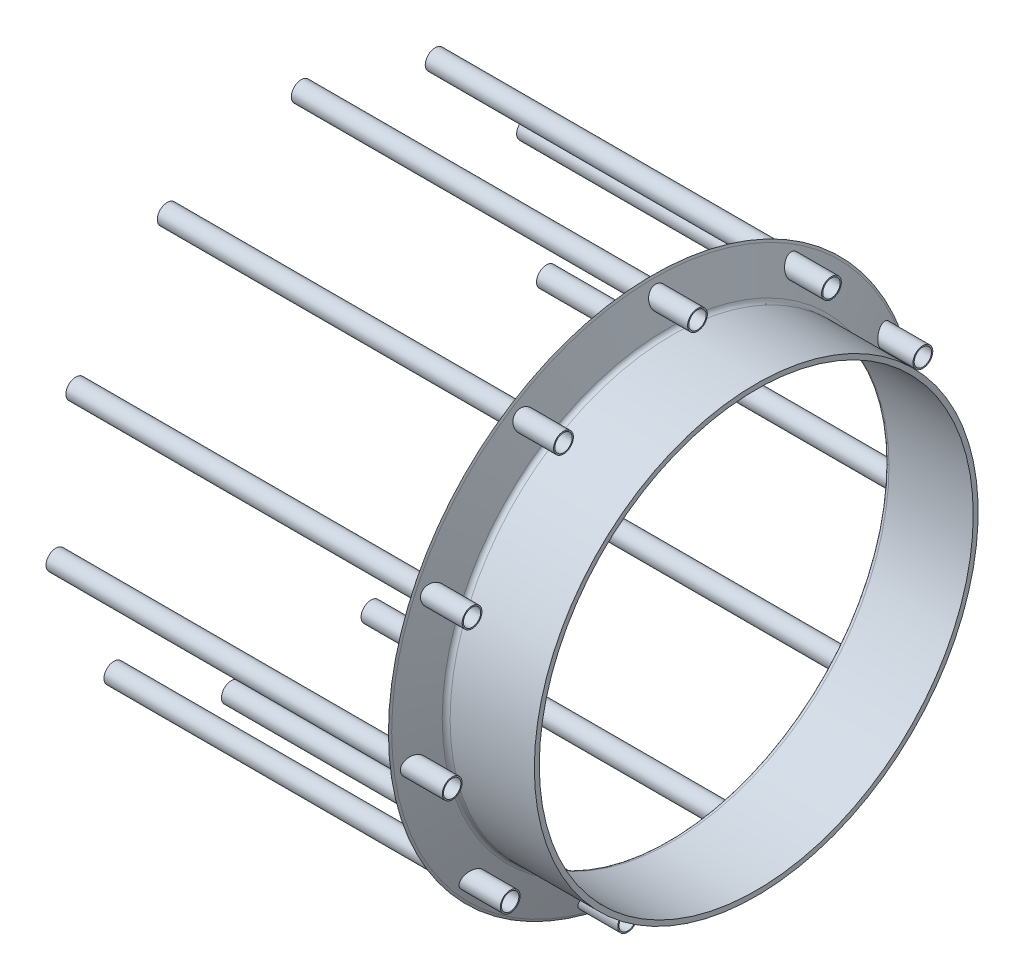
from build123d import *

# Parameters (mm, degrees)
FILLET1_R           = 5
SKETCH3_R           = 2
CUT_EXTRUDE1_DEPTH  = 10
CIRPATTERN1_COUNT   = 11
SKETCH3_2_R         = 2
BOSS_EXTRUDE1_DEPTH = 80
CIRPATTERN2_COUNT   = 11
SKETCH9_R           = 1.75
CUT_EXTRUDE2_DEPTH  = 90
CIRPATTERN3_COUNT   = 11


with BuildPart() as part:
    # Sketch1 → Revolve1 (revolve)
    with BuildSketch(Plane.XY, mode=Mode.PRIVATE) as revolve1_sk:
        with BuildLine():
            Line((40.000115753, 3.479674797), (40.000115753, 4.479674797))
            Line((40.000115753, 4.479674797), (42.926875798, -3.561532338))
            ThreePointArc((42.926875798, -3.561532338), (43.292991982, -4.038664239), (43.866568419, -4.219512195))
            Line((43.866568419, -4.219512195), (60.866568419, -4.219512195))
            Line((60.866568419, -4.219512195), (60.866568419, -5.219512195))
            Line((60.866568419, -5.219512195), (43.866568419, -5.219512195))
            ThreePointArc((43.866568419, -5.219512195), (43.292991982, -5.038664239), (42.926875798, -4.561532338))
            Line((42.926875798, -4.561532338), (40.000115753, 3.479674797))
        make_face()
    revolve(revolve1_sk.sketch.rotate(Axis((-425.6547248, -49.020325203, 0), (1, 0, 0)), 90), axis=Axis((-425.6547248, -49.020325203, 0), (1, 0, 0)))

    # Fillet1
    fillet1_edges = [part.edges().sort_by_distance(p)[0] for p in [
        (40.000115753, -49.020325203, -52.5),
    ]]
    fillet(fillet1_edges, radius=FILLET1_R)

    # Fillet2: read off the stored shape, not the designer's step
    # Fillet2 outline → Fillet2 (revolve, cut)
    with BuildSketch(Plane(origin=(0, -49.020325203, 0), x_dir=(0, 1, 0), z_dir=(0, 0, -1))):
        with BuildLine():
            Line((53.5, 40.20615199), (52.933920092, 40.20615199))
            ThreePointArc((52.933920092, 40.20615199), (53.162015685, 40.112343412), (53.381634904, 40.000115753))
            Line((53.381634904, 40.000115753), (53.5, 40.000115753))
            Line((53.5, 40.000115753), (53.5, 40.20615199))
        make_face()
    revolve(axis=Axis((0, -49.020325203, 0), (1, 0, 0)), mode=Mode.SUBTRACT)

    # Sketch3 → Cut-Extrude1 (cut)
    with BuildSketch(Plane(origin=(49, 0, 0), x_dir=(0, 0, -1), z_dir=(1, 0, 0))):
        with Locations(Location((0, 1, 0), (0, 0, 346.90891091))):
            Circle(SKETCH3_R)
    cut_extrude1 = extrude(amount=-CUT_EXTRUDE1_DEPTH, mode=Mode.SUBTRACT)

    # CirPattern1: Cut-Extrude1 ×11 about axis
    cirpattern1_axis = Axis((0, -49.020325203, 0), (1, 0, 0))
    for i in range(1, CIRPATTERN1_COUNT):
        add(cut_extrude1.rotate(cirpattern1_axis, i * 360 / CIRPATTERN1_COUNT), mode=Mode.SUBTRACT)

    # Sketch3<2> → Boss-Extrude1 (add)
    with BuildSketch(Plane(origin=(49, 0, 0), x_dir=(0, 0, -1), z_dir=(1, 0, 0))):
        with Locations((0, 1)):
            Circle(SKETCH3_2_R)
    boss_extrude1 = extrude(amount=-BOSS_EXTRUDE1_DEPTH)

    # CirPattern2: Boss-Extrude1 ×11 about axis
    cirpattern2_axis = Axis((0, -49.020325203, 0), (1, 0, 0))
    for i in range(1, CIRPATTERN2_COUNT):
        add(boss_extrude1.rotate(cirpattern2_axis, i * 360 / CIRPATTERN2_COUNT))

    # Sketch9 → Cut-Extrude2 (cut)
    with BuildSketch(Plane(origin=(49, 0, 0), x_dir=(0, 0, -1), z_dir=(1, 0, 0))):
        with Locations((0, 1)):
            Circle(SKETCH9_R)
    cut_extrude2 = extrude(amount=-CUT_EXTRUDE2_DEPTH, mode=Mode.SUBTRACT)

    # CirPattern3: Cut-Extrude2 ×11 about axis
    cirpattern3_axis = Axis((0, -49.020325203, 0), (1, 0, 0))
    for i in range(1, CIRPATTERN3_COUNT):
        add(cut_extrude2.rotate(cirpattern3_axis, i * 360 / CIRPATTERN3_COUNT), mode=Mode.SUBTRACT)


solid = part.part
